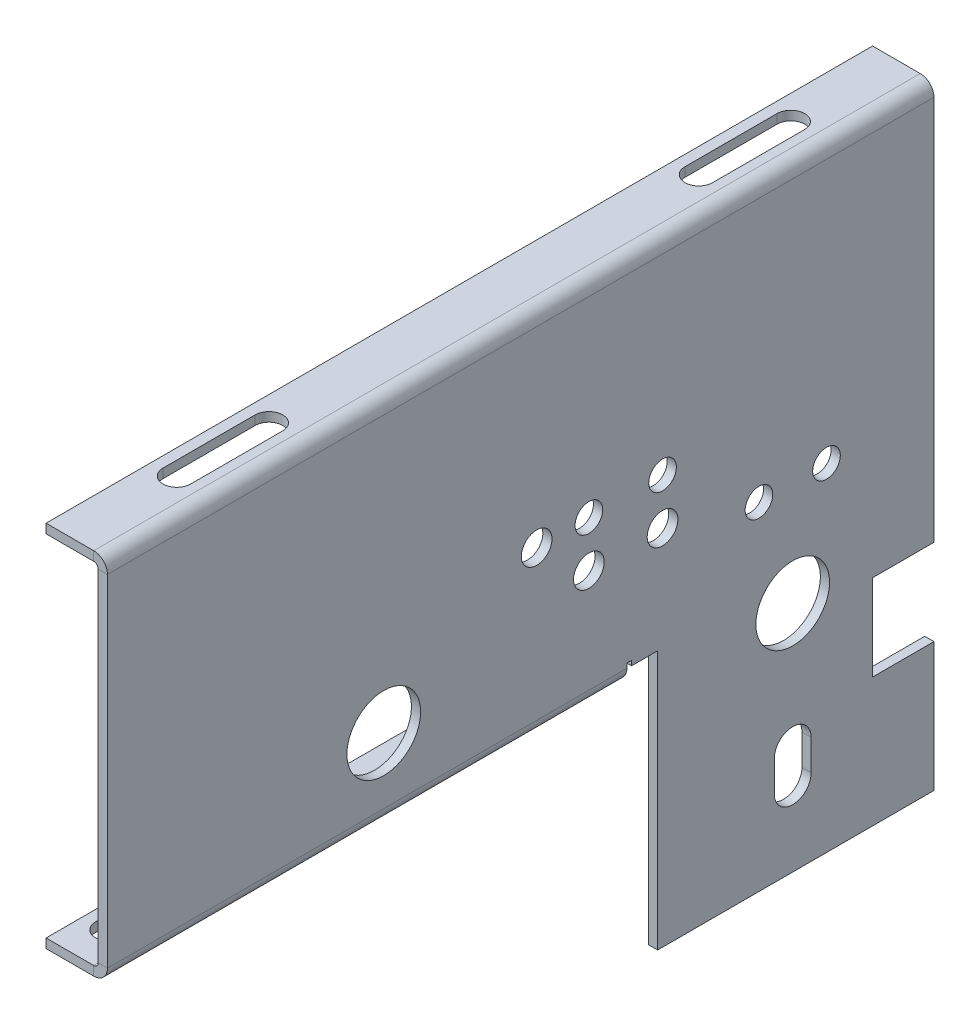
from build123d import *

# Parameters (mm, degrees)
SKETCH_1_W                        = 1.5
SKETCH_1_H                        = 100
SM_BASE_FLANGE_1_DEPTH            = 134.6
SKETCH_6_R                        = 2.25
SKETCH_6_R_2                      = 2.5
SKETCH_6_R_3                      = 6
SKETCH_6_W                        = 89.6
SKETCH_6_H                        = 40
SKETCH_6_W_2                      = 10
SKETCH_6_H_2                      = 14
CUT_EXTRUDE_1_DEPTH               = 10
SKETCH_10_W                       = 5
SKETCH_10_H                       = 2.2
CUT_EXTRUDE_2_DEPTH               = 10
SM_EDGE_FLANGE_2_STRIP_W          = 7.4732
SM_EDGE_FLANGE_2_STRIP_H          = 1.5
SM_EDGE_FLANGE_2_STRIP_CUT_DEPTH  = 84.6
SM_EDGE_FLANGE_2_RELIEF_W         = 8.2232
SM_EDGE_FLANGE_2_RELIEF_H         = 0.75
SM_EDGE_FLANGE_2_RELIEF_CUT_DEPTH = 1.5
SM_EDGE_FLANGE_2_DEPTH            = 84.6
SM_EDGE_FLANGE_3_STRIP_W          = 7.4732
SM_EDGE_FLANGE_3_STRIP_H          = 1.5
SM_EDGE_FLANGE_3_STRIP_CUT_DEPTH  = 134.6
SM_EDGE_FLANGE_3_DEPTH            = 134.6
CUT_EXTRUDE_3_DEPTH               = 10
SKETCH_18_R                       = 2.25
CUT_EXTRUDE_4_DEPTH               = 10


# Sheet-metal steps are written as plain solids
with BuildPart() as part:
    # Sketch 1 → 基体-法兰1 (new body)
    with BuildSketch(Plane.XY):
        with Locations((-0.75, -50)):
            Rectangle(SKETCH_1_W, SKETCH_1_H)
    extrude(amount=SM_BASE_FLANGE_1_DEPTH)

    # 草图6 → 切除-拉伸1 (cut)
    with BuildSketch(Plane.ZY.offset(1.5)):
        with Locations((17.5, -45.10094434)):
            Circle(SKETCH_6_R)
        with Locations((28.5, -45.10094434)):
            Circle(SKETCH_6_R)
        with Locations((44.2, -33.4)):
            Circle(SKETCH_6_R)
        with Locations((56.2, -33.4)):
            Circle(SKETCH_6_R)
        with Locations((44.2, -40.9)):
            Circle(SKETCH_6_R_2)
        with Locations((56.2, -40.9)):
            Circle(SKETCH_6_R_2)
        with Locations((64.7, -33.4)):
            Circle(SKETCH_6_R_2)
        with Locations((89.6, -47.1)):
            Circle(SKETCH_6_R_3)
        with Locations((23, -62.1)):
            Circle(SKETCH_6_R_3)
        with Locations((89.8, -80)):
            Rectangle(SKETCH_6_W, SKETCH_6_H)
        with Locations((5, -72)):
            Rectangle(SKETCH_6_W_2, SKETCH_6_H_2)
        with BuildLine():
            Line((20, -82.5), (20, -87.5))
            ThreePointArc((20, -87.5), (23, -90.5), (26, -87.5))
            Line((26, -87.5), (26, -82.5))
            ThreePointArc((26, -82.5), (23, -79.5), (20, -82.5))
        make_face()
    extrude(amount=-CUT_EXTRUDE_1_DEPTH, mode=Mode.SUBTRACT)

    # 草图10 → 切除-拉伸2 (cut)
    with BuildSketch(Plane.ZY.offset(1.5)):
        with Locations((47.5, -58.9)):
            Rectangle(SKETCH_10_W, SKETCH_10_H)
    extrude(amount=-CUT_EXTRUDE_2_DEPTH, mode=Mode.SUBTRACT)

    # 边线-法兰2 strip (across the edge) → 边线-法兰2 strip cut (cut)
    with BuildSketch(Plane(origin=(-1.5, -60, 50), x_dir=(0, 1, 0), z_dir=(0, 0, 1))):
        with Locations((-1.5, -0.75)):
            Rectangle(SM_EDGE_FLANGE_2_STRIP_W, SM_EDGE_FLANGE_2_STRIP_H)
    extrude(amount=SM_EDGE_FLANGE_2_STRIP_CUT_DEPTH, mode=Mode.SUBTRACT)

    # 边线-法兰2 relief (on the sheet) → 边线-法兰2 relief cut (cut)
    with BuildSketch(Plane(origin=(-1.5, -57.7634, 50), x_dir=(0, 1, 0), z_dir=(-1, 0, 0))):
        with Locations((-3.3616, 0.375)):
            Rectangle(SM_EDGE_FLANGE_2_RELIEF_W, SM_EDGE_FLANGE_2_RELIEF_H)
    extrude(amount=-SM_EDGE_FLANGE_2_RELIEF_CUT_DEPTH, mode=Mode.SUBTRACT)

    # 边线-法兰2 section (across the edge) → 边线-法兰2 (add)
    with BuildSketch(Plane(origin=(-1.5, -60, 50), x_dir=(0, 1, 0), z_dir=(0, 0, 1))):
        with BuildLine():
            Line((0, 0.7366), (0, 8.5))
            Line((0, 8.5), (1.5, 8.5))
            Line((1.5, 8.5), (1.5, 0.7366))
            ThreePointArc((1.5, 0.7366), (1.715745145, 0.215745145), (2.2366, 0))
            Line((2.2366, 0), (2.2366, -1.5))
            ThreePointArc((2.2366, -1.5), (0.655084973, -0.844915027), (0, 0.7366))
        make_face()
    extrude(amount=SM_EDGE_FLANGE_2_DEPTH)

    # 边线-法兰3 strip (across the edge) → 边线-法兰3 strip cut (cut)
    with BuildSketch(Plane(origin=(-1.5, 0, 134.6), x_dir=(0, -1, 0), z_dir=(0, 0, -1))):
        with Locations((-1.5, -0.75)):
            Rectangle(SM_EDGE_FLANGE_3_STRIP_W, SM_EDGE_FLANGE_3_STRIP_H)
    extrude(amount=SM_EDGE_FLANGE_3_STRIP_CUT_DEPTH, mode=Mode.SUBTRACT)

    # 边线-法兰3 section (across the edge) → 边线-法兰3 (add)
    with BuildSketch(Plane(origin=(-1.5, 0, 134.6), x_dir=(0, -1, 0), z_dir=(0, 0, -1))):
        with BuildLine():
            Line((0, 0.7366), (0, 8.5))
            Line((0, 8.5), (1.5, 8.5))
            Line((1.5, 8.5), (1.5, 0.7366))
            ThreePointArc((1.5, 0.7366), (1.715745145, 0.215745145), (2.2366, 0))
            Line((2.2366, 0), (2.2366, -1.5))
            ThreePointArc((2.2366, -1.5), (0.655084973, -0.844915027), (0, 0.7366))
        make_face()
    extrude(amount=SM_EDGE_FLANGE_3_DEPTH)

    # 草图17 → 切除-拉伸3 (cut)
    with BuildSketch(Plane.XZ.offset(1.5)):
        with BuildLine():
            Line((-8.25, 17.3), (-8.25, 32.3))
            ThreePointArc((-8.25, 32.3), (-6, 34.55), (-3.75, 32.3))
            Line((-3.75, 32.3), (-3.75, 17.3))
            ThreePointArc((-3.75, 17.3), (-6, 15.05), (-8.25, 17.3))
        make_face()
        with BuildLine():
            Line((-3.75, 117.3), (-3.75, 102.3))
            ThreePointArc((-3.75, 102.3), (-6, 100.05), (-8.25, 102.3))
            Line((-8.25, 102.3), (-8.25, 117.3))
            ThreePointArc((-8.25, 117.3), (-6, 119.55), (-3.75, 117.3))
        make_face()
    extrude(amount=-CUT_EXTRUDE_3_DEPTH, mode=Mode.SUBTRACT)

    # 草图18 → 切除-拉伸4 (cut)
    with BuildSketch(Plane.XZ.offset(60)):
        with Locations((-6, 56.3)):
            Circle(SKETCH_18_R)
        with Locations(Location((-6, 128.3, 0), (0, 0, 180))):
            Circle(SKETCH_18_R)
    extrude(amount=-CUT_EXTRUDE_4_DEPTH, mode=Mode.SUBTRACT)


solid = part.part
